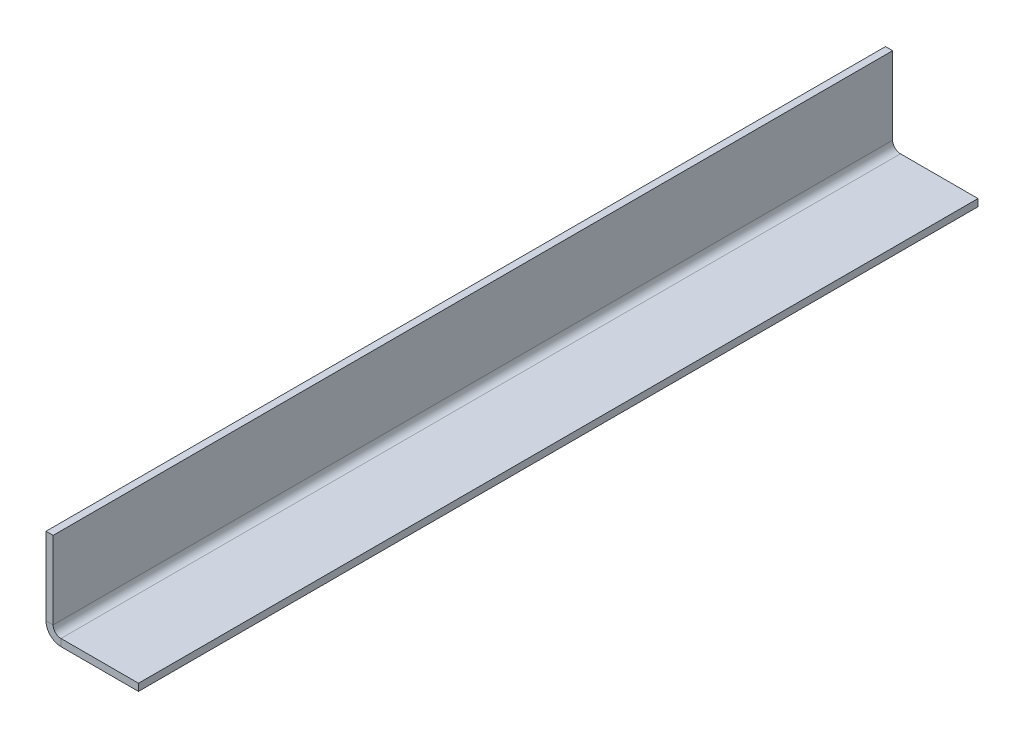
from build123d import *

# Parameters (mm, degrees)
SM_BASE_FLANGE_1_DEPTH = 118


# Sheet-metal steps are written as plain solids
with BuildPart() as part:
    # Sketch 1 → Базовая кромка1 (new body)
    with BuildSketch(Plane.XY):
        with BuildLine():
            Line((-26.892874013, 12), (-26.892874013, 1.1))
            ThreePointArc((-26.892874013, 1.1), (-26.570691472, 0.322182541), (-25.792874013, 0))
            Line((-25.792874013, 0), (-14.892874013, 0))
            Line((-14.892874013, 0), (-14.892874013, -1))
            Line((-14.892874013, -1), (-25.792874013, -1))
            ThreePointArc((-25.792874013, -1), (-27.277798253, -0.38492424), (-27.892874013, 1.1))
            Line((-27.892874013, 1.1), (-27.892874013, 12))
            Line((-27.892874013, 12), (-26.892874013, 12))
        make_face()
    extrude(amount=SM_BASE_FLANGE_1_DEPTH)


solid = part.part
